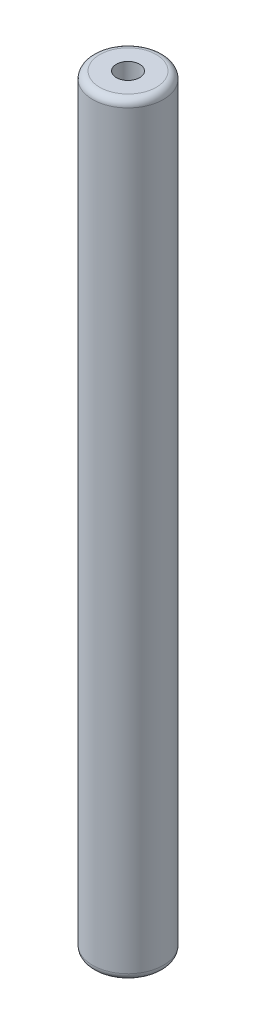
from build123d import *

# Parameters (mm, degrees)
SKETCH1_R            = 2.5
BOSS_EXTRUDE1_DEPTH  = 27
SKETCH2_R            = 0.825
CUT_EXTRUDE1_DEPTH   = 5
FILLET1_R            = 0.5
FILLET1_OF_MIRROR1_R = 0.5


with BuildPart() as part:
    # Sketch1 → Boss-Extrude1 (new body)
    with BuildSketch(Plane(origin=(0, 0, 0), x_dir=(1, 0, 0), z_dir=(0, 1, 0))):
        Circle(SKETCH1_R)
    boss_extrude1 = extrude(amount=BOSS_EXTRUDE1_DEPTH)

    # Sketch2 → Cut-Extrude1 (cut)
    with BuildSketch(Plane(origin=(0, 27, 0), x_dir=(1, 0, 0), z_dir=(0, 1, 0))):
        Circle(SKETCH2_R)
    cut_extrude1 = extrude(amount=-CUT_EXTRUDE1_DEPTH, mode=Mode.SUBTRACT)

    # Fillet1
    fillet1_edges = [part.edges().sort_by_distance(p)[0] for p in [
        (-2.5, 27, 0),
    ]]
    fillet(fillet1_edges, radius=FILLET1_R)

    # Mirror1: Boss-Extrude1, Cut-Extrude1 across plane
    add(boss_extrude1.mirror(Plane.ZX))
    add(cut_extrude1.mirror(Plane.ZX), mode=Mode.SUBTRACT)

    # Fillet1 of Mirror1
    fillet1_of_mirror1_edges = [part.edges().sort_by_distance(p)[0] for p in [
        (-2.5, -27, 0),
    ]]
    fillet(fillet1_of_mirror1_edges, radius=FILLET1_OF_MIRROR1_R)


solid = part.part
